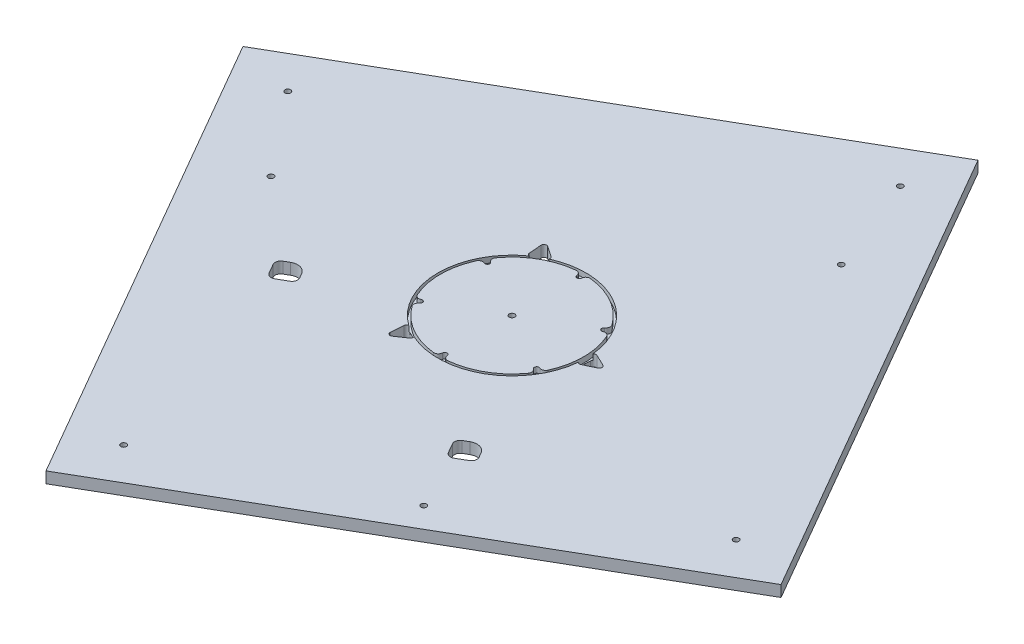
from build123d import *

# Parameters (mm, degrees)
SKETCH1_R                   = 3.175
BOSS_EXTRUDE1_DEPTH         = 12.7
SKETCH3_R                   = 83.82
SKETCH3_R_2                 = 81.9404
CUT_EXTRUDE1_DEPTH          = 6.35
CUT_EXTRUDE2_START          = -6.35
CUT_EXTRUDE2_OUTLINE_R      = 81.9404
CUT_EXTRUDE2_DEPTH          = 6.35
F_1_4_0_25_DIAMETER_HOLE1_D = 6.35
FILLET1_R                   = 6.35
CUT_EXTRUDE3_DEPTH          = 1047.720478305


# Read off the part's stored shape, not the designer's step: Cut-Extrude2
with BuildPart() as part:
    # Sketch1 → Boss-Extrude1 (new body)
    with BuildSketch(Plane.XZ.offset(-27489.985969718)):
        Polygon((556.409465543, 581.693641464), (28.480379396, 886.493641464), (-276.319620604, 358.564555317), (251.609465543, 53.764555317), align=None)
        with Locations((-206.925530091, 377.158645829)):
            Circle(SKETCH1_R, mode=Mode.SUBTRACT)
        with Locations((233.015375031, 123.158645829)):
            Circle(SKETCH1_R, mode=Mode.SUBTRACT)
        with Locations((487.015375031, 563.099550952)):
            Circle(SKETCH1_R, mode=Mode.SUBTRACT)
        with Locations((47.074469909, 817.099550952)):
            Circle(SKETCH1_R, mode=Mode.SUBTRACT)
        with BuildLine():
            Line((-37.632916951, 543.382053135), (-48.631439579, 549.732053135))
            Line((-48.631439579, 549.732053135), (-35.931439579, 571.729098391))
            Line((-35.931439579, 571.729098391), (-13.934394323, 559.029098391))
            Line((-13.934394323, 559.029098391), (-20.284394323, 548.030575763))
            ThreePointArc((-20.284394323, 548.030575763), (-27.995915078, 542.113317769), (-37.632916951, 543.382053135))
        make_face(mode=Mode.SUBTRACT)
        with BuildLine():
            Line((241.64492247, 646.10546044), (263.641967726, 633.40546044))
            Line((263.641967726, 633.40546044), (257.291967726, 622.406937812))
            ThreePointArc((257.291967726, 622.406937812), (249.580446971, 616.489679818), (239.943445098, 617.758415184))
            Line((239.943445098, 617.758415184), (228.94492247, 624.108415184))
            Line((228.94492247, 624.108415184), (241.64492247, 646.10546044))
        make_face(mode=Mode.SUBTRACT)
    extrude(amount=BOSS_EXTRUDE1_DEPTH)

    # Sketch3 → Cut-Extrude1 (cut)
    with BuildSketch(Plane.XZ.offset(-27489.985969718)):
        with Locations((140.04492247, 470.129098391)):
            Circle(SKETCH3_R)
        with Locations((140.04492247, 470.129098391)):
            Circle(SKETCH3_R_2, mode=Mode.SUBTRACT)
    extrude(amount=CUT_EXTRUDE1_DEPTH, mode=Mode.SUBTRACT)

    # Cut-Extrude2 outline → Cut-Extrude2 (cut)
    with BuildSketch(Plane(origin=(0, 27489.985969718, 0), x_dir=(1, 0, 0), z_dir=(0, 1, 0)).offset(CUT_EXTRUDE2_START)):
        with Locations((140.04492247, -470.129098391)):
            Circle(CUT_EXTRUDE2_OUTLINE_R)
        with BuildLine():
            ThreePointArc((74.203873091, -422.730325217), (99.48112247, -399.870535843), (131.916905483, -389.409690429))
            ThreePointArc((131.916905483, -389.409690429), (135.589601797, -390.547508644), (137.326798106, -393.977592825))
            ThreePointArc((137.326798106, -393.977592825), (140.04492247, -396.516851306), (142.763046834, -393.977592825))
            ThreePointArc((142.763046834, -393.977592825), (144.500243143, -390.547508644), (148.172939457, -389.409690429))
            ThreePointArc((148.172939457, -389.409690429), (180.60872247, -399.870535843), (205.885971849, -422.730325217))
            ThreePointArc((205.885971849, -422.730325217), (206.736940528, -426.479882633), (204.634998644, -429.699380858))
            ThreePointArc((204.634998644, -429.699380858), (203.794998475, -433.322974849), (207.353123009, -434.407310358))
            ThreePointArc((207.353123009, -434.407310358), (211.192261201, -434.196724402), (214.013988837, -436.808463603))
            ThreePointArc((214.013988837, -436.808463603), (221.17252247, -470.129098391), (214.013988837, -503.449733178))
            ThreePointArc((214.013988837, -503.449733178), (211.192261202, -506.06147238), (207.353123009, -505.850886424))
            ThreePointArc((207.353123009, -505.850886424), (203.794998475, -506.935221933), (204.634998644, -510.558815924))
            ThreePointArc((204.634998644, -510.558815924), (206.736940528, -513.778314149), (205.885971849, -517.527871565))
            ThreePointArc((205.885971849, -517.527871565), (180.60872247, -540.387660939), (148.172939457, -550.848506352))
            ThreePointArc((148.172939457, -550.848506352), (144.500243143, -549.710688138), (142.763046834, -546.280603957))
            ThreePointArc((142.763046834, -546.280603957), (140.04492247, -543.741345476), (137.326798106, -546.280603957))
            ThreePointArc((137.326798106, -546.280603957), (135.589601797, -549.710688138), (131.916905483, -550.848506352))
            ThreePointArc((131.916905483, -550.848506352), (99.48112247, -540.387660939), (74.203873091, -517.527871565))
            ThreePointArc((74.203873091, -517.527871565), (73.352904412, -513.778314149), (75.454846296, -510.558815924))
            ThreePointArc((75.454846296, -510.558815924), (76.294846465, -506.935221933), (72.736721931, -505.850886424))
            ThreePointArc((72.736721931, -505.850886424), (68.897583739, -506.06147238), (66.075856104, -503.449733178))
            ThreePointArc((66.075856104, -503.449733178), (58.91732247, -470.12909839), (66.075856104, -436.808463603))
            ThreePointArc((66.075856104, -436.808463603), (68.897583739, -434.196724402), (72.736721931, -434.407310358))
            ThreePointArc((72.736721931, -434.407310358), (76.294846465, -433.322974849), (75.454846296, -429.699380858))
            ThreePointArc((75.454846296, -429.699380858), (73.352904412, -426.479882633), (74.203873091, -422.730325217))
        make_face(mode=Mode.SUBTRACT)
    extrude(amount=CUT_EXTRUDE2_DEPTH, mode=Mode.SUBTRACT)

    # 1/4 (0.25) Diameter Hole1 (through all)
    with Locations(Plane(origin=(0, 27477.285969718, 0), x_dir=(-1, 0, 0), z_dir=(0, -1, 0))):
        with Locations((-276.56992247, -706.597334894), (-276.56992247, -233.660861887), (133.00507753, -470.129098391), (-140.04492247, -470.129098391)):
            Hole(F_1_4_0_25_DIAMETER_HOLE1_D / 2)

    # Fillet1
    fillet1_edges = [part.edges().sort_by_distance(p)[0] for p in [
        (-13.934394323, 27483.635969718, 559.029098391),
        (-35.931439579, 27483.635969718, 571.729098391),
        (-48.631439579, 27483.635969718, 549.732053135),
        (241.64492247, 27483.635969718, 646.10546044),
        (228.94492247, 27483.635969718, 624.108415184),
        (263.641967726, 27483.635969718, 633.40546044),
    ]]
    fillet(fillet1_edges, radius=FILLET1_R)

    # Sketch7 → Cut-Extrude3 (cut, through all)
    with BuildSketch(Plane(origin=(0, 27489.985969718, 0), x_dir=(1, 0, 0), z_dir=(0, 1, 0))):
        with BuildLine():
            Line((87.519099271, -555.383941842), (88.589697985, -541.194514974))
            ThreePointArc((88.589697985, -541.194514974), (90.165199445, -538.685494585), (93.125578624, -538.569119019))
            Line((93.125578624, -538.569119019), (98.706273756, -541.238167012))
            ThreePointArc((98.706273756, -541.238167012), (98.923894245, -541.352808536), (99.131986961, -541.483952646))
            Line((99.131986961, -541.483952646), (104.233797894, -544.982452404))
            ThreePointArc((104.233797894, -544.982452404), (105.613203287, -547.604403762), (104.228078621, -550.223338244))
            Line((104.228078621, -550.223338244), (92.474973845, -558.245217361))
            ThreePointArc((92.474973845, -558.245217361), (89.0976004, -558.372448725), (87.519099271, -555.383941842))
        make_face()
        with BuildLine():
            Line((92.474973844, -382.01297942), (104.228078621, -390.034858537))
            ThreePointArc((104.228078621, -390.034858537), (105.613203286, -392.65379302), (104.233797893, -395.275744378))
            Line((104.233797893, -395.275744378), (99.131986961, -398.774244135))
            ThreePointArc((99.131986961, -398.774244135), (98.923894245, -398.905388245), (98.706273756, -399.020029769))
            Line((98.706273756, -399.020029769), (93.125578624, -401.689077763))
            ThreePointArc((93.125578624, -401.689077763), (90.165199444, -401.572702196), (88.589697984, -399.063681808))
            Line((88.589697984, -399.063681808), (87.519099271, -384.874254939))
            ThreePointArc((87.519099271, -384.874254939), (89.0976004, -381.885748056), (92.474973844, -382.01297942))
        make_face()
        with BuildLine():
            Line((240.140694294, -472.990373909), (227.316990804, -479.157921661))
            ThreePointArc((227.316990804, -479.157921661), (224.356364679, -479.048007567), (222.775390892, -476.542431776))
            Line((222.775390892, -476.542431776), (222.296506693, -470.374884024))
            ThreePointArc((222.296506693, -470.374884024), (222.28697892, -470.12909839), (222.296506693, -469.883312757))
            Line((222.296506693, -469.883312757), (222.775390892, -463.715765005))
            ThreePointArc((222.775390892, -463.715765005), (224.356364679, -461.210189214), (227.316990804, -461.10027512))
            Line((227.316990804, -461.10027512), (240.140694294, -467.267822872))
            ThreePointArc((240.140694294, -467.267822872), (241.939566609, -470.12909839), (240.140694294, -472.990373909))
        make_face()
    extrude(amount=-CUT_EXTRUDE3_DEPTH, mode=Mode.SUBTRACT)


solid = part.part
